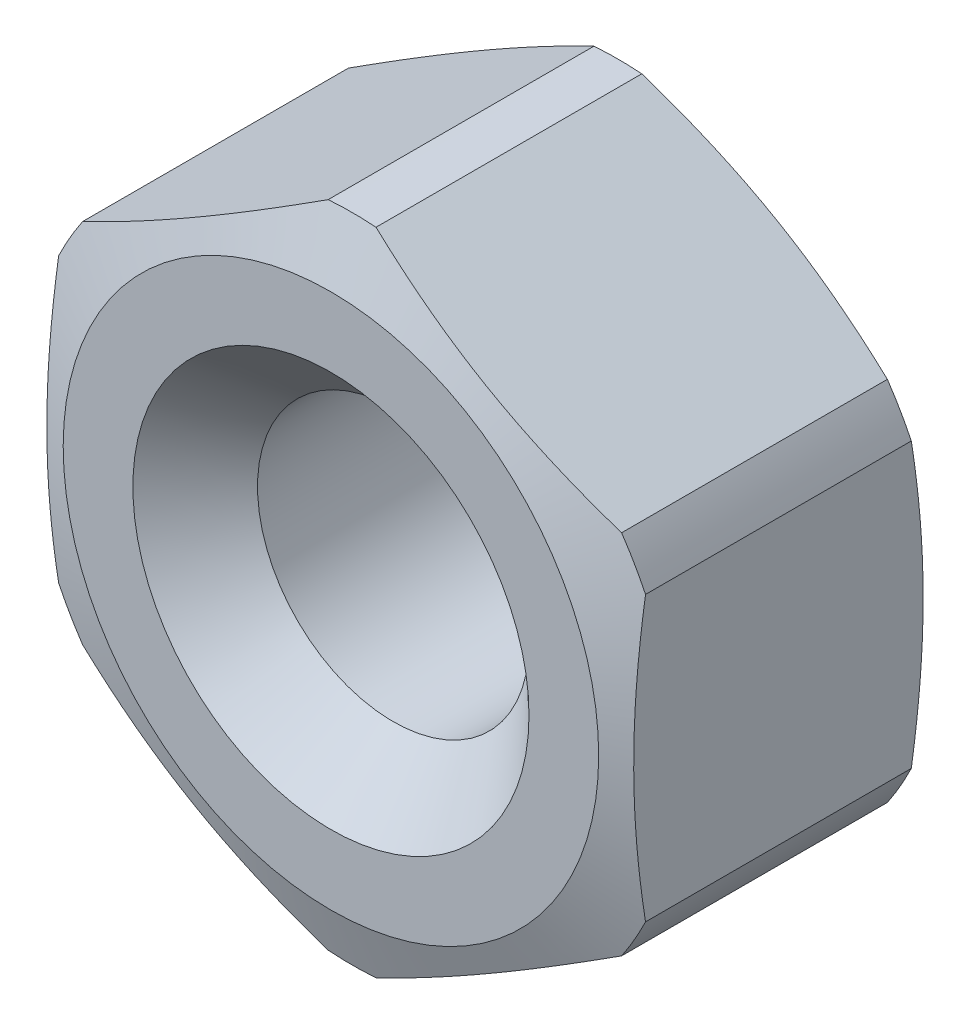
from build123d import *

# Parameters (mm, degrees)
SKETCH_2_OUTSIDE_W  = 25.07
SKETCH_2_OUTSIDE_H  = 25.07
CUT_EXTRUDE_1_DEPTH = 16.114445077


with BuildPart() as part:
    # Эскиз1 → Повернуть1 (revolve)
    with BuildSketch(Plane(origin=(0, 0, 0), x_dir=(0, 0, -1), z_dir=(1, 0, 0))):
        Polygon((-2.500961894, 3.700961894), (2.500961894, 3.700961894), (4.2, 5.4), (4.2, 7.3), (3.623107179, 8.885), (-3.623107179, 8.885), (-4.2, 7.3), (-4.2, 5.4), align=None)
    revolve(axis=Axis((0, 0, 152.740188543), (0, 0, -1)))

    # Эскиз2 outside → Вырез-Вытянуть1 (cut, through all)
    with BuildSketch(Plane.XY.offset(4.2)):
        Rectangle(SKETCH_2_OUTSIDE_W, SKETCH_2_OUTSIDE_H)
        Polygon((0, -9.237604307), (8, -4.618802154), (8, 4.618802154), (0, 9.237604307), (-8, 4.618802154), (-8, -4.618802154), align=None, mode=Mode.SUBTRACT)
    extrude(amount=-CUT_EXTRUDE_1_DEPTH, mode=Mode.SUBTRACT)


solid = part.part
